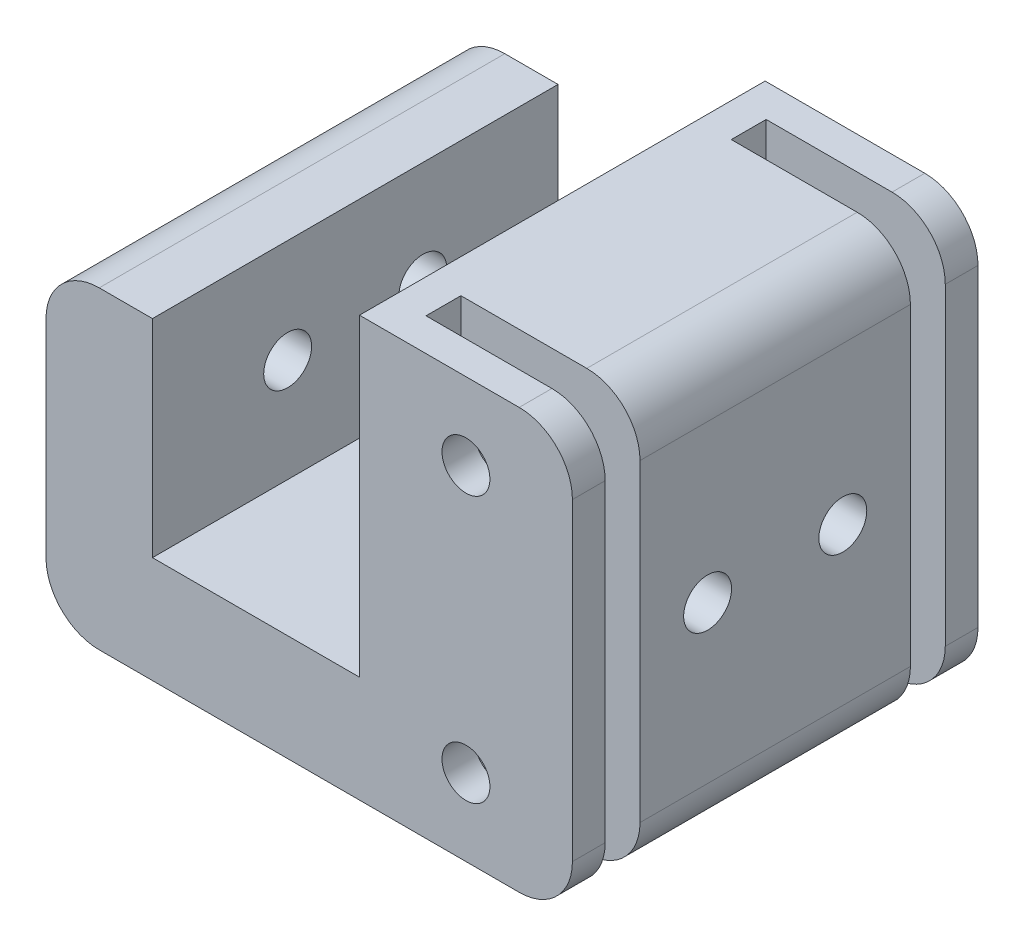
from build123d import *

# Parameters (mm, degrees)
SKETCH1_R               = 2.25
BOSS_EXTRUDE1_DEPTH     = 19.05
CUT_EXTRUDE1_DEPTH      = 41.441980045
CUT_EXTRUDE1_DEPTH_BACK = 41.441980045
SKETCH2_W               = 16.825
SKETCH2_H               = 3.275
CUT_EXTRUDE2_DEPTH      = 41.441980045
CUT_EXTRUDE2_DEPTH_BACK = 41.441980045
SKETCH4_R               = 2.25


with BuildPart() as part:
    # Sketch1 → Boss-Extrude1 (new, symmetric)
    with BuildSketch(Plane.XY):
        with BuildLine():
            Line((-9.725, 9.725), (-14.725, 9.725))
            ThreePointArc((-14.725, 9.725), (-18.260533906, 8.260533906), (-19.725, 4.725))
            Line((-19.725, 4.725), (-19.725, -14.725))
            ThreePointArc((-19.725, -14.725), (-18.260533906, -18.260533906), (-14.725, -19.725))
            Line((-14.725, -19.725), (24.725, -19.725))
            ThreePointArc((24.725, -19.725), (28.260533906, -18.260533906), (29.725, -14.725))
            Line((29.725, -14.725), (29.725, 14.725))
            ThreePointArc((29.725, 14.725), (28.260533906, 18.260533906), (24.725, 19.725))
            Line((24.725, 19.725), (9.725, 19.725))
            Line((9.725, 19.725), (9.725, 9.725))
            Line((9.725, 9.725), (9.725, -9.725))
            Line((9.725, -9.725), (-9.725, -9.725))
            Line((-9.725, -9.725), (-9.725, 9.725))
        make_face()
        with Locations((19.725, 12.5)):
            Circle(SKETCH1_R, mode=Mode.SUBTRACT)
        with Locations((19.725, -12.5)):
            Circle(SKETCH1_R, mode=Mode.SUBTRACT)
    extrude(amount=BOSS_EXTRUDE1_DEPTH, both=True)

    # Sketch2 → Cut-Extrude1 (cut, two sides: drawn at the far end of the back side and taken through both)
    with BuildSketch(Plane(origin=(0, 0, 0), x_dir=(1, 0, 0), z_dir=(0, 1, 0)).offset(-CUT_EXTRUDE1_DEPTH_BACK)):
        with Locations((21.3125, 14.3375)):
            Rectangle(SKETCH2_W, SKETCH2_H)
        with Locations((21.3125, -14.3375)):
            Rectangle(SKETCH2_W, SKETCH2_H)
    extrude(amount=CUT_EXTRUDE1_DEPTH + CUT_EXTRUDE1_DEPTH_BACK, mode=Mode.SUBTRACT)

    # Sketch4 → Cut-Extrude2 (cut, two sides: drawn at the far end of the back side and taken through both)
    with BuildSketch(Plane(origin=(0, 0, 0), x_dir=(0, 0, -1), z_dir=(1, 0, 0)).offset(-CUT_EXTRUDE2_DEPTH_BACK)):
        with Locations((-6.35, 0)):
            Circle(SKETCH4_R)
        with Locations((6.35, 0)):
            Circle(SKETCH4_R)
    extrude(amount=CUT_EXTRUDE2_DEPTH + CUT_EXTRUDE2_DEPTH_BACK, mode=Mode.SUBTRACT)


solid = part.part
